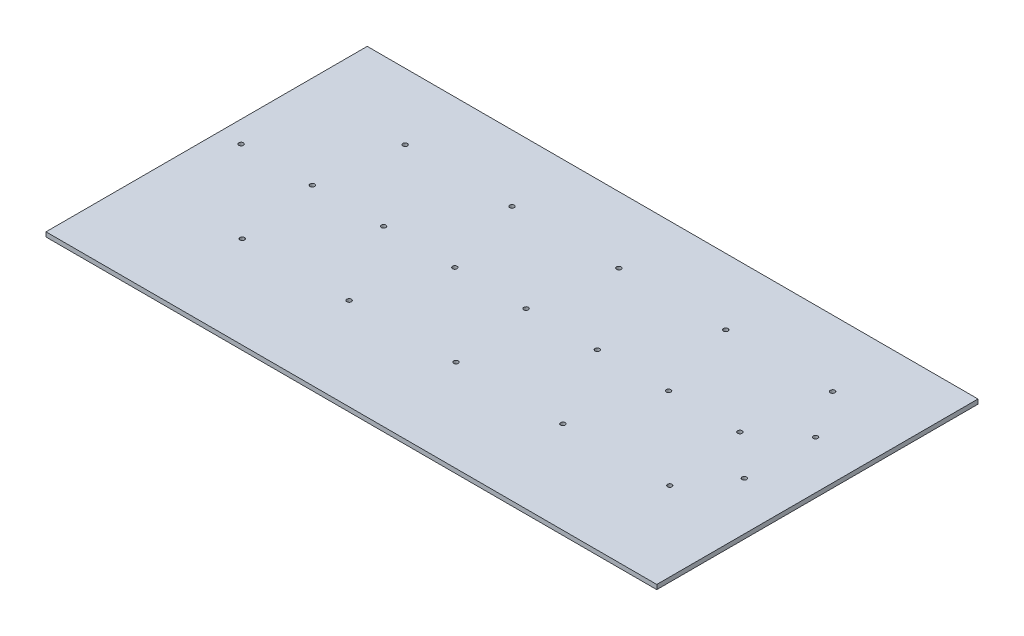
from build123d import *

# Parameters (mm, degrees)
SKETCH1_W               = 857.25
SKETCH1_H               = 450.85
BOSS_EXTRUDE1_DEPTH     = 6.35
CUT_EXTRUDE1_DEPTH      = 969.598785618
CUT_EXTRUDE1_DEPTH_BACK = 969.598785618
SKETCH2_R               = 3.175


with BuildPart() as part:
    # Sketch1 → Boss-Extrude1 (new body)
    with BuildSketch(Plane(origin=(0, 0, 0), x_dir=(1, 0, 0), z_dir=(0, 1, 0))):
        with Locations((428.625, 225.425)):
            Rectangle(SKETCH1_W, SKETCH1_H)
    extrude(amount=BOSS_EXTRUDE1_DEPTH)

    # Sketch2 → Cut-Extrude1 (cut, two sides: drawn at the far end of the back side and taken through both)
    with BuildSketch(Plane(origin=(0, 6.35, 0), x_dir=(1, 0, 0), z_dir=(0, 1, 0)).offset(-CUT_EXTRUDE1_DEPTH_BACK)):
        with Locations((30.25, 243.56780677)):
            Circle(SKETCH2_R)
        with Locations((130.25, 243.56780677)):
            Circle(SKETCH2_R)
        with Locations((230.25, 243.56780677)):
            Circle(SKETCH2_R)
        with Locations((330.25, 243.56780677)):
            Circle(SKETCH2_R)
        with Locations((430.25, 243.56780677)):
            Circle(SKETCH2_R)
        with Locations((530.25, 243.56780677)):
            Circle(SKETCH2_R)
        with Locations((630.25, 243.56780677)):
            Circle(SKETCH2_R)
        with Locations((730.25, 243.56780677)):
            Circle(SKETCH2_R)
        with Locations((146.163, 357.86780677)):
            Circle(SKETCH2_R)
        with Locations((296.163, 357.86780677)):
            Circle(SKETCH2_R)
        with Locations((446.163, 357.86780677)):
            Circle(SKETCH2_R)
        with Locations((596.163, 357.86780677)):
            Circle(SKETCH2_R)
        with Locations((746.163, 357.86780677)):
            Circle(SKETCH2_R)
        with Locations((146.163, 129.26780677)):
            Circle(SKETCH2_R)
        with Locations((296.163, 129.26780677)):
            Circle(SKETCH2_R)
        with Locations((446.163, 129.26780677)):
            Circle(SKETCH2_R)
        with Locations((596.163, 129.26780677)):
            Circle(SKETCH2_R)
        with Locations((746.163, 129.26780677)):
            Circle(SKETCH2_R)
        with Locations((789.66304, 190.46656677)):
            Circle(SKETCH2_R)
        with Locations((789.66304, 290.46636677)):
            Circle(SKETCH2_R)
    extrude(amount=CUT_EXTRUDE1_DEPTH + CUT_EXTRUDE1_DEPTH_BACK, mode=Mode.SUBTRACT)


solid = part.part
